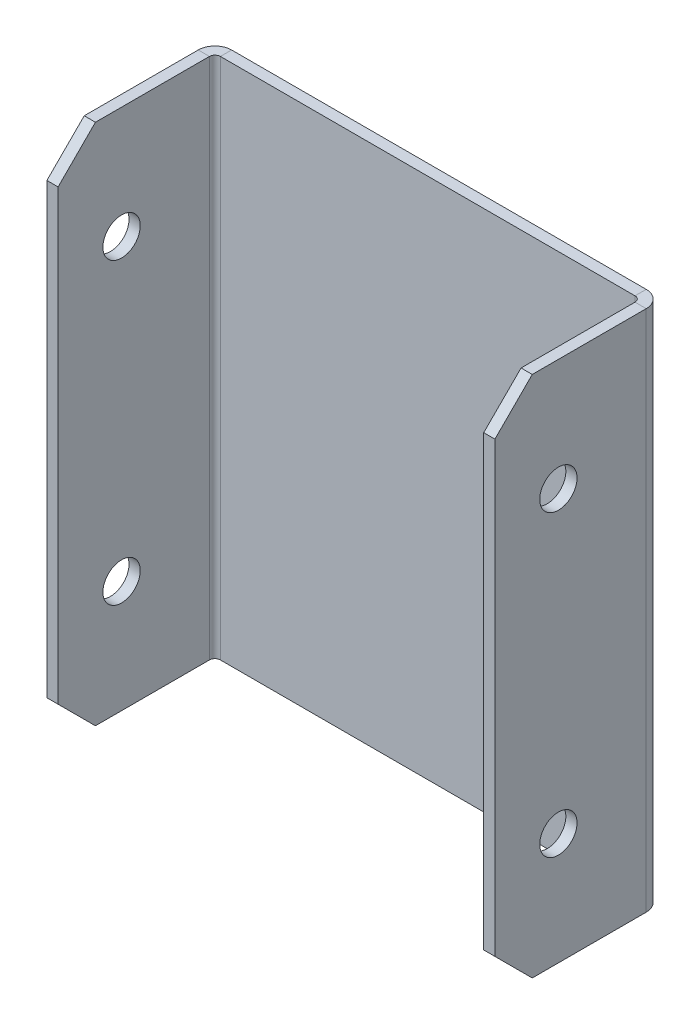
from build123d import *

# Parameters (mm, degrees)
CROQUIS1_W                         = 60
CROQUIS1_H                         = 70
BRIDA_BASE1_DEPTH                  = 1.5
BRIDA_DE_ARISTA1_STRIP_W           = 7.4732
BRIDA_DE_ARISTA1_STRIP_H           = 1.5
BRIDA_DE_ARISTA1_STRIP_CUT_DEPTH   = 70
BRIDA_DE_ARISTA1_STRIP_2_W         = 7.4732
BRIDA_DE_ARISTA1_STRIP_2_H         = 1.5
BRIDA_DE_ARISTA1_STRIP_CUT_2_DEPTH = 70
BRIDA_DE_ARISTA1_DEPTH             = 70
BRIDA_DE_ARISTA1_BEND_DEPTH        = 70
ROMPER_START                       = 36.062445841
ROMPER_ESQUINA1_OUTLINE_W          = 64
ROMPER_ESQUINA1_OUTLINE_H          = 51.062445841
ROMPER_ESQUINA1_DEPTH              = 3.535533905
ROMPER_START_2                     = -13.435028843
ROMPER_ESQUINA1_2_OUTLINE_W        = 64
ROMPER_ESQUINA1_2_OUTLINE_H        = 3.937554159
ROMPER_ESQUINA1_2_DEPTH            = 7.071067812
CROQUIS13_R                        = 2.5
CORTAR_EXTRUIR1_DEPTH              = 73.567210226


# Read off the part's stored shape, not the designer's step: Romper esquina1
# Sheet-metal steps are written as plain solids
with BuildPart() as part:
    # Croquis1 → Brida base1 (new body)
    with BuildSketch(Plane.XY):
        Rectangle(CROQUIS1_W, CROQUIS1_H)
    extrude(amount=-BRIDA_BASE1_DEPTH)

    # Brida de arista1 strip (across the edge) → Brida de arista1 strip cut (cut)
    with BuildSketch(Plane(origin=(30, -35, 0), x_dir=(-1, 0, 0), z_dir=(0, 1, 0))):
        with Locations((-1.5, -0.75)):
            Rectangle(BRIDA_DE_ARISTA1_STRIP_W, BRIDA_DE_ARISTA1_STRIP_H)
    extrude(amount=BRIDA_DE_ARISTA1_STRIP_CUT_DEPTH, mode=Mode.SUBTRACT)

    # Brida de arista1 strip 2 (across the edge) → Brida de arista1 strip cut 2 (cut)
    with BuildSketch(Plane(origin=(-30, 35, 0), x_dir=(1, 0, 0), z_dir=(0, -1, 0))):
        with Locations((-1.5, -0.75)):
            Rectangle(BRIDA_DE_ARISTA1_STRIP_2_W, BRIDA_DE_ARISTA1_STRIP_2_H)
    extrude(amount=BRIDA_DE_ARISTA1_STRIP_CUT_2_DEPTH, mode=Mode.SUBTRACT)

    # Brida de arista1 section (across the edge) → Brida de arista1 (add)
    with BuildSketch(Plane(origin=(30, -35, 0), x_dir=(-1, 0, 0), z_dir=(0, 1, 0))):
        with BuildLine():
            Line((0, 0.7366), (0, 21))
            Line((0, 21), (1.5, 21))
            Line((1.5, 21), (1.5, 0.7366))
            ThreePointArc((1.5, 0.7366), (1.715745145, 0.215745145), (2.2366, 0))
            Line((2.2366, 0), (2.2366, -1.5))
            ThreePointArc((2.2366, -1.5), (0.655084973, -0.844915027), (0, 0.7366))
        make_face()
    extrude(amount=BRIDA_DE_ARISTA1_DEPTH)

    # Brida de arista1 section 2 (across the edge) → Brida de arista1 bend (add)
    with BuildSketch(Plane(origin=(-30, 35, 0), x_dir=(1, 0, 0), z_dir=(0, -1, 0))):
        with BuildLine():
            Line((0, 0.7366), (0, 21))
            Line((0, 21), (1.5, 21))
            Line((1.5, 21), (1.5, 0.7366))
            ThreePointArc((1.5, 0.7366), (1.715745145, 0.215745145), (2.2366, 0))
            Line((2.2366, 0), (2.2366, -1.5))
            ThreePointArc((2.2366, -1.5), (0.655084973, -0.844915027), (0, 0.7366))
        make_face()
    extrude(amount=BRIDA_DE_ARISTA1_BEND_DEPTH)

    # Romper esquina1 outline → Romper esquina1 (cut)
    with BuildSketch(Plane(origin=(0, 0, 0), x_dir=(1, 0, 0), z_dir=(0, 0.707106781186548, 0.707106781186547)).offset(ROMPER_START)):
        with Locations((0, -10.53122292)):
            Rectangle(ROMPER_ESQUINA1_OUTLINE_W, ROMPER_ESQUINA1_OUTLINE_H)
    extrude(amount=ROMPER_ESQUINA1_DEPTH, mode=Mode.SUBTRACT)

    # Romper esquina1 2 outline → Romper esquina1 2 (cut)
    with BuildSketch(Plane(origin=(0, 0, 0), x_dir=(1, 0, 0), z_dir=(0, 0.707106781186548, 0.707106781186547)).offset(ROMPER_START_2)):
        with Locations((0, -38.03122292)):
            Rectangle(ROMPER_ESQUINA1_2_OUTLINE_W, ROMPER_ESQUINA1_2_OUTLINE_H)
    extrude(amount=ROMPER_ESQUINA1_2_DEPTH, mode=Mode.SUBTRACT)

    # Croquis13 → Cortar-Extruir1 (cut, through all)
    with BuildSketch(Plane(origin=(30, 0, 0), x_dir=(0, 0, -1), z_dir=(1, 0, 0))):
        with Locations((-12.5, 20)):
            Circle(CROQUIS13_R)
        with Locations((-12.5, -20)):
            Circle(CROQUIS13_R)
    extrude(amount=-CORTAR_EXTRUIR1_DEPTH, mode=Mode.SUBTRACT)


solid = part.part
